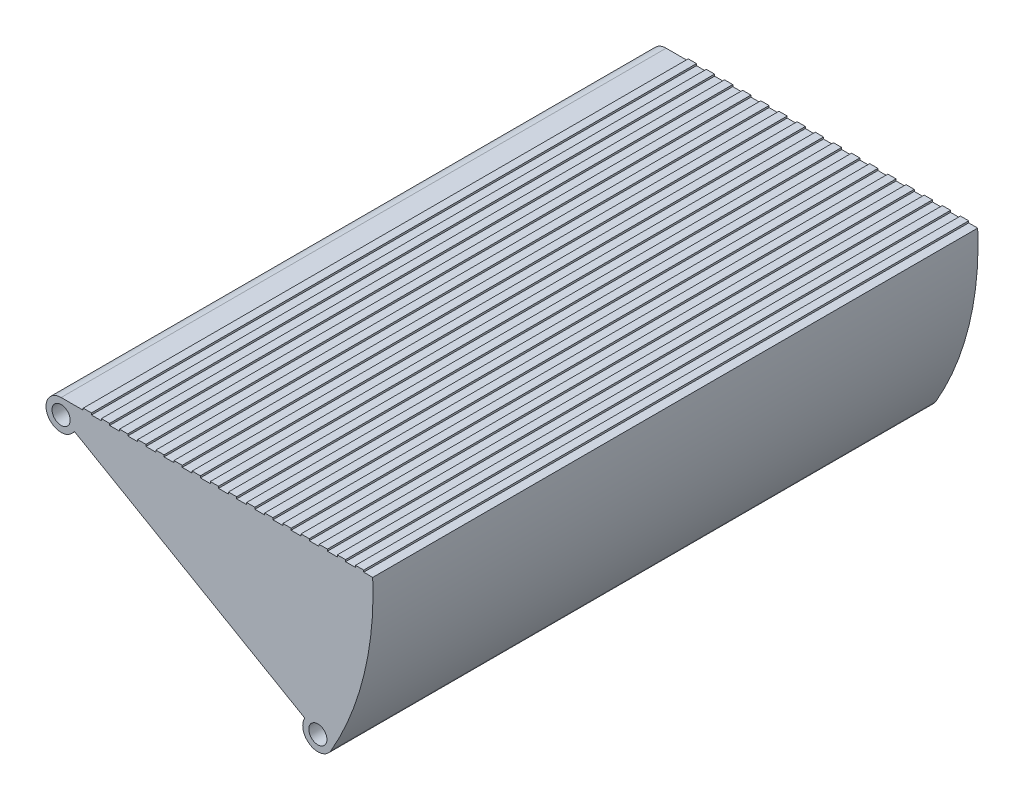
from build123d import *

# Parameters (mm, degrees)
SKETCH1_R           = 15
BOSS_EXTRUDE1_DEPTH = 1000
SKETCH2_W           = 13.606398545
SKETCH2_H           = 3.01775833
BOSS_EXTRUDE2_DEPTH = 1000
SHELL1_START        = 20
SHELL1_DEPTH        = 960


# Read off the part's stored shape, not the designer's step: Shell1
with BuildPart() as part:
    # Sketch1 → Boss-Extrude1 (new body)
    with BuildSketch(Plane.XY):
        with BuildLine():
            Line((90.647552146, 270), (-424.352447854, 270))
            ThreePointArc((-424.352447854, 270), (-446.003082949, 232.5), (-402.70181276, 232.5))
            Line((-402.70181276, 232.5), (-21.650635095, 12.5))
            ThreePointArc((-21.650635095, 12.5), (-12.5, -21.650635095), (21.650635095, -12.5))
            ThreePointArc((21.650635095, -12.5), (76.346217655, 123.817117551), (90.647552146, 270))
        make_face()
        with Locations((-424.352447854, 245)):
            Circle(SKETCH1_R, mode=Mode.SUBTRACT)
        Circle(SKETCH1_R, mode=Mode.SUBTRACT)
    extrude(amount=BOSS_EXTRUDE1_DEPTH)

    # Sketch2 → Boss-Extrude2 (add)
    with BuildSketch(Plane.XY.offset(1000)):
        with Locations((-381.021044878, 271.508879165)):
            Rectangle(SKETCH2_W, SKETCH2_H)
        with Locations((-351.021044878, 271.508879165)):
            Rectangle(SKETCH2_W, SKETCH2_H)
        with Locations((-321.021044878, 271.508879165)):
            Rectangle(SKETCH2_W, SKETCH2_H)
        with Locations((-291.021044878, 271.508879165)):
            Rectangle(SKETCH2_W, SKETCH2_H)
        with Locations((-261.021044878, 271.508879165)):
            Rectangle(SKETCH2_W, SKETCH2_H)
        with Locations((-231.021044879, 271.508879165)):
            Rectangle(SKETCH2_W, SKETCH2_H)
        with Locations((-201.021044879, 271.508879165)):
            Rectangle(SKETCH2_W, SKETCH2_H)
        with Locations((-171.021044878, 271.508879165)):
            Rectangle(SKETCH2_W, SKETCH2_H)
        with Locations((-141.021044878, 271.508879165)):
            Rectangle(SKETCH2_W, SKETCH2_H)
        with Locations((-111.021044879, 271.508879165)):
            Rectangle(SKETCH2_W, SKETCH2_H)
        with Locations((-81.021044879, 271.508879165)):
            Rectangle(SKETCH2_W, SKETCH2_H)
        with Locations((-51.021044879, 271.508879165)):
            Rectangle(SKETCH2_W, SKETCH2_H)
        with Locations((-21.021044878, 271.508879165)):
            Rectangle(SKETCH2_W, SKETCH2_H)
        with Locations((8.978955122, 271.508879165)):
            Rectangle(SKETCH2_W, SKETCH2_H)
        with Locations((38.978955122, 271.508879165)):
            Rectangle(SKETCH2_W, SKETCH2_H)
        with Locations((68.978955122, 271.508879165)):
            Rectangle(SKETCH2_W, SKETCH2_H)
    extrude(amount=-BOSS_EXTRUDE2_DEPTH)

    # Shell1 outline → Shell1 (cut)
    with BuildSketch(Plane.XY.offset(SHELL1_START)):
        with BuildLine():
            ThreePointArc((20.675289686, 28.240616077), (58.720352341, 136.205240665), (71.151752213, 250))
            Line((71.151752213, 250), (-389.711431703, 250))
            ThreePointArc((-389.711431703, 250), (-389.983130142, 238.385621722), (-394.041558722, 227.5))
            Line((-394.041558722, 227.5), (-30.310889132, 17.5))
            ThreePointArc((-30.310889132, 17.5), (-7.214665799, 34.248337148), (20.675289686, 28.240616077))
        make_face()
    extrude(amount=SHELL1_DEPTH, mode=Mode.SUBTRACT)


solid = part.part
